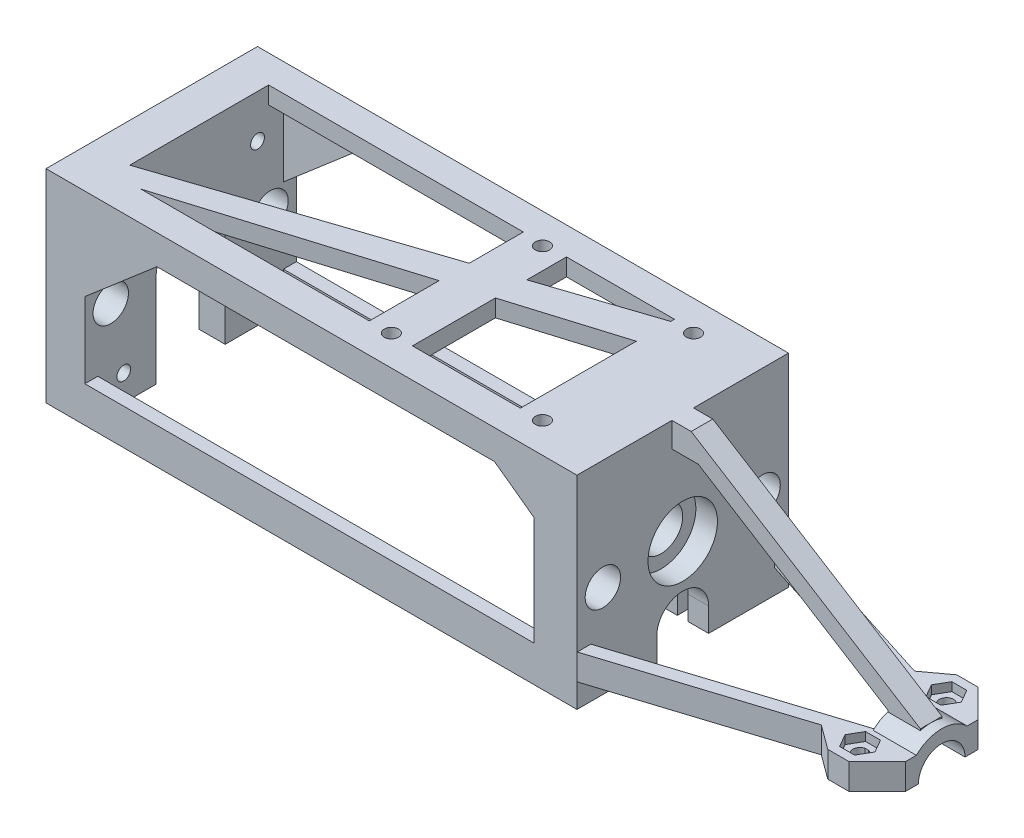
from build123d import *

# Parameters (mm, degrees)
SKETCH1_W           = 123
SKETCH1_H           = 43
SKETCH1_R           = 1.65
BOSS_EXTRUDE1_DEPTH = 4
SKETCH1_3_W         = 9
SKETCH1_3_H         = 43
SKETCH1_3_W_2       = 10
BOSS_EXTRUDE2_DEPTH = 43
SKETCH3_R           = 4.1
SKETCH3_R_2         = 1.6
CUT_EXTRUDE2_DEPTH  = 43
SKETCH4_R           = 4.1
SKETCH4_R_2         = 5
CUT_EXTRUDE3_DEPTH  = 43
SKETCH4_3_R         = 8.05
SKETCH4_3_R_2       = 5
CUT_EXTRUDE4_DEPTH  = 5
SKETCH6_W           = 123
SKETCH6_H           = 47
BOSS_EXTRUDE3_DEPTH = 3
CUT_EXTRUDE6_DEPTH  = 1.25
CUT_EXTRUDE7_DEPTH  = 3
SKETCH4_4_R         = 4.1
CUT_EXTRUDE9_DEPTH  = 150
BOSS_EXTRUDE4_DEPTH = 60
CUT_EXTRUDE10_DEPTH = 50
BOSS_EXTRUDE5_DEPTH = 2.5
SKETCH13_R          = 1.65
BOSS_EXTRUDE6_DEPTH = 6
SKETCH16_W          = 10
SKETCH16_H          = 3
BOSS_EXTRUDE7_DEPTH = 6
CUT_EXTRUDE12_DEPTH = 2


with BuildPart() as part:
    # Sketch1 → Boss-Extrude1 (new body)
    with BuildSketch(Plane(origin=(0, 0, 0), x_dir=(1, 0, 0), z_dir=(0, 1, 0))):
        Rectangle(SKETCH1_W, SKETCH1_H)
        Polygon((-52.5, -14.099191616), (-52.5, 18.074317133), (6.5, 18.074317133), (6.5, 5.553846247), align=None, mode=Mode.SUBTRACT)
        Polygon((-46.425759264, -17.608655655), (6.5, -1.439808114), (6.5, -17.608655655), align=None, mode=Mode.SUBTRACT)
        with Locations((11.5, 17.5)):
            Circle(SKETCH1_R, mode=Mode.SUBTRACT)
        with Locations((11.5, -17.5)):
            Circle(SKETCH1_R, mode=Mode.SUBTRACT)
        Polygon((16.5, 18.074317133), (41.5, 18.074317133), (41.5, 17.212428031), (16.5, 8.884869614), align=None, mode=Mode.SUBTRACT)
        Polygon((16.5, 1.615197193), (41.5, 9.252710459), (41.5, -17.608655655), (16.5, -17.608655655), align=None, mode=Mode.SUBTRACT)
        with Locations((46.5, 17.5)):
            Circle(SKETCH1_R, mode=Mode.SUBTRACT)
        with Locations((46.5, -17.5)):
            Circle(SKETCH1_R, mode=Mode.SUBTRACT)
    extrude(amount=BOSS_EXTRUDE1_DEPTH)

    # Sketch1<3> → Boss-Extrude2 (add)
    with BuildSketch(Plane(origin=(0, 0, 0), x_dir=(1, 0, 0), z_dir=(0, 1, 0))):
        with Locations((-57, 0)):
            Rectangle(SKETCH1_3_W, SKETCH1_3_H)
        with Locations((56.5, 0)):
            Rectangle(SKETCH1_3_W_2, SKETCH1_3_H)
    extrude(amount=-BOSS_EXTRUDE2_DEPTH)

    # Sketch3 → Cut-Extrude2 (cut)
    with BuildSketch(Plane(origin=(-52.5, 0, 0), x_dir=(0, 0, -1), z_dir=(1, 0, 0))):
        with BuildLine():
            Line((-8, -43), (8, -43))
            Line((8, -43), (8, -21.5))
            ThreePointArc((8, -21.5), (0, -13.5), (-8, -21.5))
            Line((-8, -21.5), (-8, -43))
        make_face()
        with Locations((18.5, -21.5)):
            Circle(SKETCH3_R)
        with Locations((-18.5, -21.5)):
            Circle(SKETCH3_R)
        with Locations((15.5, -37)):
            Circle(SKETCH3_R_2)
        with Locations((15.5, -6)):
            Circle(SKETCH3_R_2)
        with Locations((-15.5, -6)):
            Circle(SKETCH3_R_2)
        with Locations((-15.5, -37)):
            Circle(SKETCH3_R_2)
    extrude(amount=-CUT_EXTRUDE2_DEPTH, mode=Mode.SUBTRACT)

    # Sketch4 → Cut-Extrude3 (cut)
    with BuildSketch(Plane(origin=(61.5, 0, 0), x_dir=(0, 0, -1), z_dir=(1, 0, 0))):
        with BuildLine():
            Line((-6, -43), (6, -43))
            Line((6, -43), (6, -37.5))
            ThreePointArc((6, -37.5), (0, -31.5), (-6, -37.5))
            Line((-6, -37.5), (-6, -43))
        make_face()
        with BuildLine():
            ThreePointArc((21.5, -18.705362278), (16.998334258, -17.684898429), (14.4, -21.5))
            ThreePointArc((14.4, -21.5), (16.998334258, -25.315101571), (21.5, -24.294637722))
            Line((21.5, -24.294637722), (21.5, -18.705362278))
        make_face()
        with Locations((-18.5, -21.5)):
            Circle(SKETCH4_R)
        with Locations((0, -21.5)):
            Circle(SKETCH4_R_2)
    extrude(amount=-CUT_EXTRUDE3_DEPTH, mode=Mode.SUBTRACT)

    # Sketch4<3> → Cut-Extrude4 (cut)
    with BuildSketch(Plane(origin=(61.5, 0, 0), x_dir=(0, 0, -1), z_dir=(1, 0, 0))):
        with Locations((0, -21.5)):
            Circle(SKETCH4_3_R)
        with Locations((0, -21.5)):
            Circle(SKETCH4_3_R_2, mode=Mode.SUBTRACT)
    extrude(amount=-CUT_EXTRUDE4_DEPTH, mode=Mode.SUBTRACT)

    # Sketch6 → Boss-Extrude3 (add)
    with BuildSketch(Plane(origin=(0, 0, -21.5), x_dir=(-1, 0, 0), z_dir=(0, 0, -1))):
        with Locations((0, -19.5)):
            Rectangle(SKETCH6_W, SKETCH6_H)
        Polygon((-51.5, -34.656603278), (-51.5, -9.423954755), (-42.40711897, -2.82645379), (35.817070487, -2.82645379), (52.5, -17.16769062), (52.5, -34.656603278), align=None, mode=Mode.SUBTRACT)
    boss_extrude3 = extrude(amount=BOSS_EXTRUDE3_DEPTH)

    # Mirror1: Boss-Extrude3 across plane
    add(boss_extrude3.mirror(Plane.XY))

    # Sketch7 → Cut-Extrude6 (cut, symmetric)
    with BuildSketch(Plane(origin=(55.5, 0, 0), x_dir=(0, 0, -1), z_dir=(1, 0, 0))):
        with BuildLine():
            ThreePointArc((12.5, -34.490529316), (12.278204733, -33.856933451), (11.709666808, -33.5))
            Line((11.709666808, -33.5), (1.443160895, -31.162233309))
            ThreePointArc((1.443160895, -31.162233309), (0, -31), (-1.443160895, -31.162233309))
            Line((-1.443160895, -31.162233309), (-11.709666808, -33.5))
            ThreePointArc((-11.709666808, -33.5), (-12.278204733, -33.856933451), (-12.5, -34.490529316))
            Line((-12.5, -34.490529316), (-12.5, -59.657999149))
            Line((-12.5, -59.657999149), (12.5, -59.657999149))
            Line((12.5, -59.657999149), (12.5, -34.490529316))
        make_face()
    extrude(amount=CUT_EXTRUDE6_DEPTH, both=True, mode=Mode.SUBTRACT)

    # Sketch8 → Cut-Extrude7 (cut)
    with BuildSketch(Plane.ZY.offset(61.5)):
        with BuildLine():
            Line((-8, -43), (-8, -29.761355821))
            ThreePointArc((-8, -29.761355821), (0, -33), (8, -29.761355821))
            Line((8, -29.761355821), (8, -43))
            Line((8, -43), (11.5, -43))
            Line((11.5, -43), (11.5, -21.5))
            ThreePointArc((11.5, -21.5), (0, -10), (-11.5, -21.5))
            Line((-11.5, -21.5), (-11.5, -43))
            Line((-11.5, -43), (-8, -43))
        make_face()
    extrude(amount=-CUT_EXTRUDE7_DEPTH, mode=Mode.SUBTRACT)

    # Sketch4<4> → Cut-Extrude9 (cut)
    with BuildSketch(Plane(origin=(61.5, 0, 0), x_dir=(0, 0, -1), z_dir=(1, 0, 0))):
        with Locations((18.5, -21.5)):
            Circle(SKETCH4_4_R)
        with Locations((-18.5, -21.5)):
            Circle(SKETCH4_4_R)
    extrude(amount=-CUT_EXTRUDE9_DEPTH, mode=Mode.SUBTRACT)

    # Sketch10 → Boss-Extrude4 (add)
    with BuildSketch(Plane(origin=(61.5, 0, 0), x_dir=(0, 0, -1), z_dir=(1, 0, 0))):
        with BuildLine():
            Line((8.4, -37.5), (5.4, -37.5))
            ThreePointArc((5.4, -37.5), (0, -32.1), (-5.4, -37.5))
            Line((-5.4, -37.5), (-8.4, -37.5))
            ThreePointArc((-8.4, -37.5), (0, -29.1), (8.4, -37.5))
        make_face()
    extrude(amount=BOSS_EXTRUDE4_DEPTH)

    # Sketch10<2> → Cut-Extrude10 (cut)
    with BuildSketch(Plane(origin=(61.5, 0, 0), x_dir=(0, 0, -1), z_dir=(1, 0, 0))):
        with BuildLine():
            Line((8.4, -37.5), (5.4, -37.5))
            ThreePointArc((5.4, -37.5), (0, -32.1), (-5.4, -37.5))
            Line((-5.4, -37.5), (-8.4, -37.5))
            ThreePointArc((-8.4, -37.5), (0, -29.1), (8.4, -37.5))
        make_face()
    extrude(amount=CUT_EXTRUDE10_DEPTH, mode=Mode.SUBTRACT)


with BuildPart() as cut_extrude10_piece_1:
    # of the separate pieces the step leaves, piece 1, a body of its own (cut_extrude10_pieces)
    add(part.part.solids().sort_by_distance((61.5, 4, -24.5))[0])



with BuildPart() as cut_extrude10_piece_2:
    # of the separate pieces the step leaves, piece 2, a body of its own (cut_extrude10_pieces)
    add(part.part.solids().sort_by_distance((111.5, -37.5, 5.4))[0])


with BuildPart() as cut_extrude10_piece_1_1:
    add(cut_extrude10_piece_1.part)

    add(cut_extrude10_piece_2.part)  # Boss-Extrude5 merges Cut-Extrude10 piece 2
    # Sketch12 → Boss-Extrude5 (add, symmetric)
    with BuildSketch(Plane.XY):
        Polygon((67.613999688, -1.745978237), (111.5, -29.1), (111.5, -30.1), (119.062017117, -30.1), (119.062017117, -29.1), (65.957335733, 4), (61.5, 4), (61.5, -1.745978237), align=None)
    extrude(amount=BOSS_EXTRUDE5_DEPTH, both=True)

    # Sketch13 → Boss-Extrude6 (add)
    with BuildSketch(Plane.XZ.offset(37.5)):
        Polygon((111.5, -5.4), (61.5, -21.289920577), (61.5, -24.43777103), (104.408435864, -10.80153827), (110.040329232, -14.939140036), (114.94386108, -14.939140036), (121.5, -8.4), (121.405179946, -5.4), align=None)
        with Locations((112.574775129, -10)):
            Circle(SKETCH13_R, mode=Mode.SUBTRACT)
    boss_extrude6 = extrude(amount=-BOSS_EXTRUDE6_DEPTH)

    # Mirror2: Boss-Extrude6 across plane
    add(boss_extrude6.mirror(Plane.XY))

    # Sketch16 → Boss-Extrude7 (add)
    with BuildSketch(Plane.XZ.offset(37.5)):
        with Locations((116.5, -6.9)):
            Rectangle(SKETCH16_W, SKETCH16_H)
        with Locations((116.5, 6.9)):
            Rectangle(SKETCH16_W, SKETCH16_H)
    extrude(amount=-BOSS_EXTRUDE7_DEPTH)

    # Sketch17 → Cut-Extrude12 (cut)
    with BuildSketch(Plane(origin=(0, -31.5, 0), x_dir=(1, 0, 0), z_dir=(0, 1, 0))):
        Polygon((114.306825936, 7), (116.038876744, 10), (114.306825936, 13), (110.842724321, 13), (109.110673513, 10), (110.842724321, 7), align=None)
        Polygon((116.038876744, -10), (114.306825936, -7), (110.842724321, -7), (109.110673513, -10), (110.842724321, -13), (114.306825936, -13), align=None)
    extrude(amount=-CUT_EXTRUDE12_DEPTH, mode=Mode.SUBTRACT)


solid = cut_extrude10_piece_1_1.part
